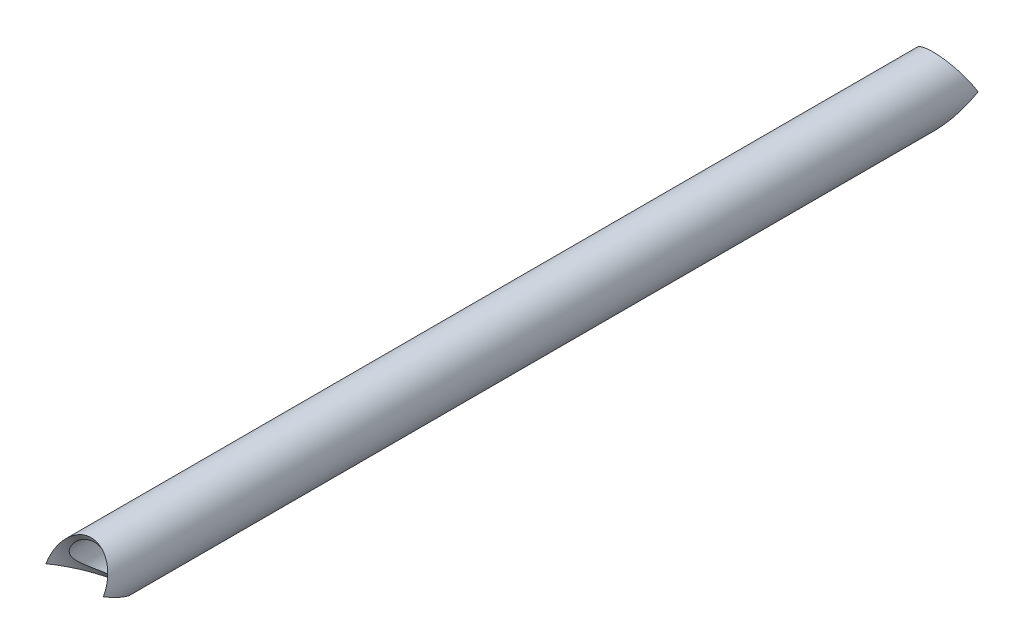
from build123d import *

# Parameters (mm, degrees)
EXTRUDE_START           = -144.053658799
EXTRUDE_1_OUTLINE_R     = 10.65
EXTRUDE_1_OUTLINE_R_2   = 8.65
EXTRUDE_1_DEPTH         = 144.053658799
EXTRUDE_START_2         = -162.5000001
EXTRUDE_1_2_OUTLINE_R   = 10.65
EXTRUDE_1_2_OUTLINE_R_2 = 8.65
EXTRUDE_1_2_DEPTH       = 18.446341301
EXTRUDE_START_3         = -9.22317055
EXTRUDE_1_3_DEPTH       = 100.22317055


with BuildPart() as part:
    # Бобышка-Вытянуть1: read off the stored shape, not the designer's step
    # Бобышка-Вытянуть1 outline → Бобышка-Вытянуть1 (new body)
    with BuildSketch(Plane.XY.offset(EXTRUDE_START)):
        Circle(EXTRUDE_1_OUTLINE_R)
        Circle(EXTRUDE_1_OUTLINE_R_2, mode=Mode.SUBTRACT)
    extrude(amount=EXTRUDE_1_DEPTH)

    # Extrude 1 2 outline → Extrude 1 2 (add)
    with BuildSketch(Plane.XY.offset(EXTRUDE_START_2)):
        Circle(EXTRUDE_1_2_OUTLINE_R)
        Circle(EXTRUDE_1_2_OUTLINE_R_2, mode=Mode.SUBTRACT)
    extrude(amount=EXTRUDE_1_2_DEPTH)

    # Extrude 1 3 outline → Extrude 1 3 (cut)
    with BuildSketch(Plane(origin=(0, 0, 0), x_dir=(1, 0, 0), z_dir=(0, 0.8660254037845098, -0.4999999999998769)).offset(EXTRUDE_START_3)):
        with BuildLine():
            ThreePointArc((-10.65, 140.729128115), (0, 130.079128115), (10.65, 140.729128115))
            Line((10.65, 140.729128115), (10.65, 148))
            Line((10.65, 148), (-10.65, 148))
            Line((-10.65, 148), (-10.65, 140.729128115))
        make_face()
    extrude(amount=EXTRUDE_1_3_DEPTH, mode=Mode.SUBTRACT)

    # Зеркальное отражение1: part across plane


with BuildPart() as part_1:
    add(part.part)
    add(part.part.mirror(Plane.XY))


solid = part_1.part
